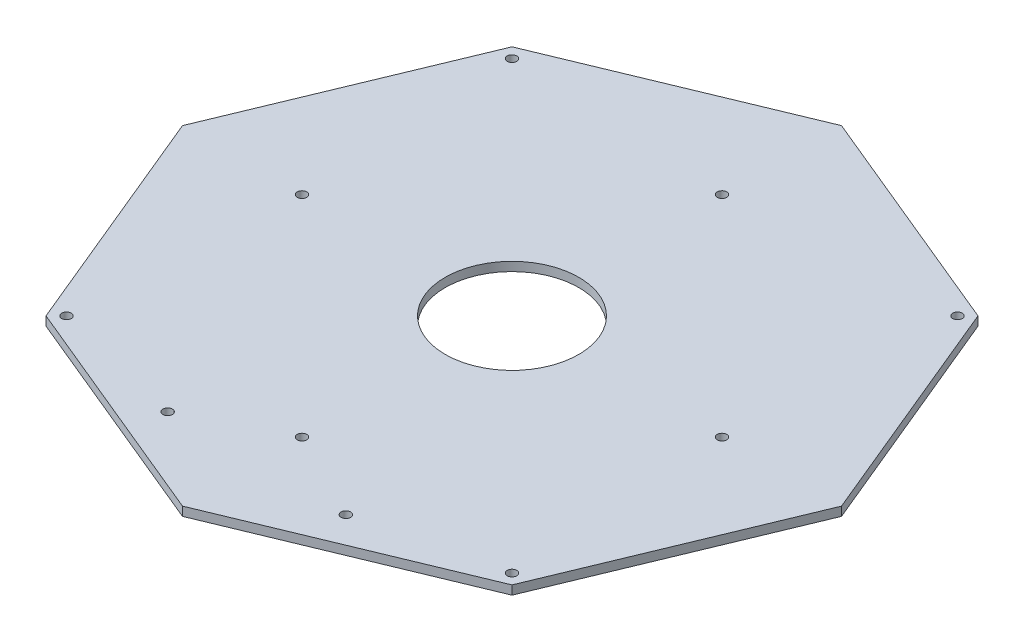
from build123d import *

# Parameters (mm, degrees)
BOSS_EXTRUDE2_DEPTH     = 3
CUT_EXTRUDE3_DEPTH      = 157.928885299
CUT_EXTRUDE3_DEPTH_BACK = 157.928885299
SKETCH3_R               = 1.6
CUT_EXTRUDE4_DEPTH      = 157.928885299
CUT_EXTRUDE4_DEPTH_BACK = 157.928885299
SKETCH4_R               = 1.6
CUT_EXTRUDE6_DEPTH      = 157.928885299
CUT_EXTRUDE6_DEPTH_BACK = 157.928885299
SKETCH6_R               = 22.5


with BuildPart() as part:
    # Sketch1 → Boss-Extrude2 (new body)
    with BuildSketch(Plane(origin=(0, 0, 0), x_dir=(1, 0, 0), z_dir=(0, 1, 0))):
        Polygon((0, -110.94520053), (78.450103635, -78.450103635), (110.94520053, 0), (78.450103635, 78.450103635), (0, 110.94520053), (-78.450103635, 78.450103635), (-110.94520053, 0), (-78.450103635, -78.450103635), align=None)
    extrude(amount=BOSS_EXTRUDE2_DEPTH)

    # Sketch3 → Cut-Extrude3 (cut, two sides: drawn at the far end of the back side and taken through both)
    with BuildSketch(Plane(origin=(0, 3, 0), x_dir=(1, 0, 0), z_dir=(0, 1, 0)).offset(-CUT_EXTRUDE3_DEPTH_BACK)):
        with Locations((-75, -75)):
            Circle(SKETCH3_R)
        with Locations((75, -75)):
            Circle(SKETCH3_R)
        with Locations((75, 75)):
            Circle(SKETCH3_R)
        with Locations((-75, 75)):
            Circle(SKETCH3_R)
        with Locations((-70.710678119, 0)):
            Circle(SKETCH3_R)
        with Locations((0, 70.710678119)):
            Circle(SKETCH3_R)
        with Locations((70.710678119, 0)):
            Circle(SKETCH3_R)
        with Locations((0, -70.710678119)):
            Circle(SKETCH3_R)
    extrude(amount=CUT_EXTRUDE3_DEPTH + CUT_EXTRUDE3_DEPTH_BACK, mode=Mode.SUBTRACT)

    # Sketch4 → Cut-Extrude4 (cut, two sides: drawn at the far end of the back side and taken through both)
    with BuildSketch(Plane(origin=(0, 3, 0), x_dir=(1, 0, 0), z_dir=(0, 1, 0)).offset(-CUT_EXTRUDE4_DEPTH_BACK)):
        with Locations((-30, -85.94520053)):
            Circle(SKETCH4_R)
        with Locations((30, -85.94520053)):
            Circle(SKETCH4_R)
    extrude(amount=CUT_EXTRUDE4_DEPTH + CUT_EXTRUDE4_DEPTH_BACK, mode=Mode.SUBTRACT)

    # Sketch6 → Cut-Extrude6 (cut, two sides: drawn at the far end of the back side and taken through both)
    with BuildSketch(Plane(origin=(0, 3, 0), x_dir=(1, 0, 0), z_dir=(0, 1, 0)).offset(-CUT_EXTRUDE6_DEPTH_BACK)):
        Circle(SKETCH6_R)
    extrude(amount=CUT_EXTRUDE6_DEPTH + CUT_EXTRUDE6_DEPTH_BACK, mode=Mode.SUBTRACT)


solid = part.part
